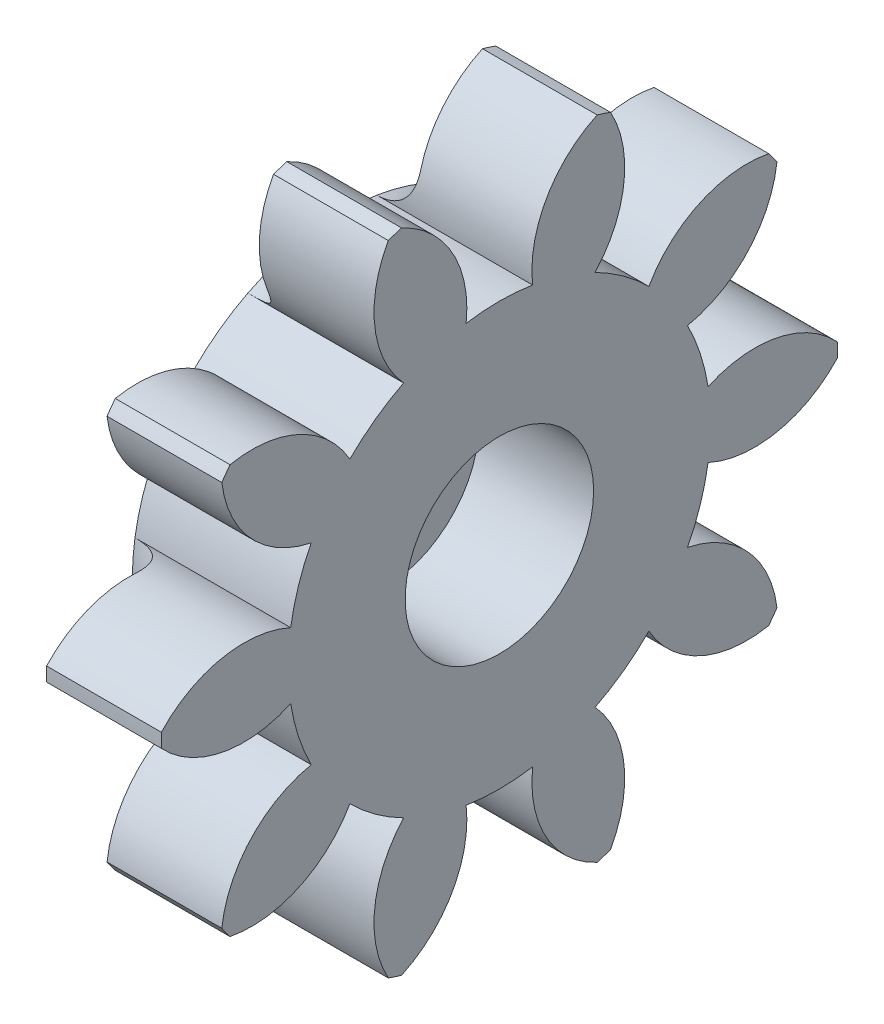
from build123d import *

# Parameters (mm, degrees)
BASPROSKE_W         = 2
BASPROSKE_H         = 8.25
TOOTHCUT_DEPTH      = 12.837440602
TEETHCUTS_COUNT     = 10
TEETHCUTS_ANGLE     = 324
BORSKE_R            = 2.5
BORE_DEPTH          = 50.0000508
BOSS_EXTRUDE1_START = 0.8
SKETCH1_R           = 2.5
BOSS_EXTRUDE1_DEPTH = 0.8
SKETCH2_R           = 2.55
SKETCH2_R_2         = 2.3
BOSS_EXTRUDE2_DEPTH = 2.8
BOSS_EXTRUDE3_START = 1
SKETCH3_R           = 5.15525
SKETCH3_R_2         = 1
BOSS_EXTRUDE3_DEPTH = 1
FILLET1_R           = 1


with BuildPart() as part:
    # BasProSke → Base-Revolve (revolve)
    with BuildSketch(Plane(origin=(0, 0, 0), x_dir=(1, 0, 0), z_dir=(0, 1, 0)), mode=Mode.PRIVATE) as base_revolve_sk:
        with Locations((1, 4.125)):
            Rectangle(BASPROSKE_W, BASPROSKE_H)
    revolve(base_revolve_sk.sketch.rotate(Axis((-10, 0, 0), (1, 0, 0)), 180), axis=Axis((-10, 0, 0), (1, 0, 0)))

    # TooCutSke → ToothCut (cut, through all)
    with BuildSketch(Plane(origin=(0, 0, 0), x_dir=(0, 0, -1), z_dir=(1, 0, 0))):
        with BuildLine():
            ThreePointArc((0.810777273, 5.091094458), (0, 5.15525), (-0.810777273, 5.091094458))
            ThreePointArc((-0.810777273, 5.091094458), (-1.154893166, 6.765492881), (-2.421785774, 7.913102983))
            ThreePointArc((-2.421785774, 7.913102983), (0, 8.2754), (2.421785774, 7.913102983))
            ThreePointArc((2.421785774, 7.913102983), (1.154893166, 6.765492881), (0.810777273, 5.091094458))
        make_face()
    toothcut = extrude(amount=TOOTHCUT_DEPTH, mode=Mode.SUBTRACT)

    # TeethCuts: ToothCut ×10 about axis
    teethcuts_axis = Axis((-10, 0, 0), (1, 0, 0))
    for i in range(1, TEETHCUTS_COUNT):
        add(toothcut.rotate(teethcuts_axis, i * TEETHCUTS_ANGLE / (TEETHCUTS_COUNT - 1)), mode=Mode.SUBTRACT)

    # BorSke → Bore (cut, symmetric)
    with BuildSketch(Plane(origin=(0, 0, 0), x_dir=(0, 0, -1), z_dir=(1, 0, 0))):
        with Locations(Location((0, 0, 0), (0, 0, 180))):
            Circle(BORSKE_R)
    extrude(amount=BORE_DEPTH, both=True, mode=Mode.SUBTRACT)

    # Sketch1 → Boss-Extrude1 (add)
    with BuildSketch(Plane.ZY.offset(BOSS_EXTRUDE1_START)):
        with BuildLine():
            ThreePointArc((-5.092462515, 0.802139699), (-6.772423309, 0.99612057), (-8.248240616, 0.170372351))
            ThreePointArc((-8.248240616, 0.170372351), (-8.25, 0), (-8.248240616, -0.170372351))
            ThreePointArc((-8.248240616, -0.170372351), (-6.772423309, -0.99612057), (-5.092462515, -0.802139699))
            ThreePointArc((-5.092462515, -0.802139699), (-4.902934106, -1.59305986), (-4.591374603, -2.344329716))
            ThreePointArc((-4.591374603, -2.344329716), (-6.06451053, -3.174852073), (-6.773109188, -4.710360064))
            ThreePointArc((-6.773109188, -4.710360064), (-6.674390204, -4.849228331), (-6.572824477, -4.986028319))
            ThreePointArc((-6.572824477, -4.986028319), (-4.893500569, -4.786609013), (-3.648402832, -3.642219012))
            ThreePointArc((-3.648402832, -3.642219012), (-3.030179922, -4.17068486), (-2.336537648, -4.59534486))
            ThreePointArc((-2.336537648, -4.59534486), (-3.040160855, -6.133139134), (-2.710880259, -7.791895034))
            ThreePointArc((-2.710880259, -7.791895034), (-2.549390204, -7.846216259), (-2.386812789, -7.897190938))
            ThreePointArc((-2.386812789, -7.897190938), (-1.145426936, -6.748775503), (-0.810777273, -5.091094458))
            ThreePointArc((-0.810777273, -5.091094458), (0, -5.15525), (0.810777273, -5.091094458))
            ThreePointArc((0.810777273, -5.091094458), (1.145426936, -6.748775503), (2.386812789, -7.897190938))
            ThreePointArc((2.386812789, -7.897190938), (2.549390204, -7.846216259), (2.710880259, -7.791895034))
            ThreePointArc((2.710880259, -7.791895034), (3.040160855, -6.133139134), (2.336537648, -4.59534486))
            ThreePointArc((2.336537648, -4.59534486), (3.030179922, -4.17068486), (3.648402832, -3.642219012))
            ThreePointArc((3.648402832, -3.642219012), (4.893500569, -4.786609013), (6.572824477, -4.986028319))
            ThreePointArc((6.572824477, -4.986028319), (6.674390204, -4.849228331), (6.773109188, -4.710360064))
            ThreePointArc((6.773109188, -4.710360064), (6.06451053, -3.174852073), (4.591374603, -2.344329716))
            ThreePointArc((4.591374603, -2.344329716), (4.902934106, -1.59305986), (5.092462515, -0.802139699))
            ThreePointArc((5.092462515, -0.802139699), (6.772423309, -0.99612057), (8.248240616, -0.170372351))
            ThreePointArc((8.248240616, -0.170372351), (8.25, 0), (8.248240616, 0.170372351))
            ThreePointArc((8.248240616, 0.170372351), (6.772423309, 0.99612057), (5.092462515, 0.802139699))
            ThreePointArc((5.092462515, 0.802139699), (4.902934106, 1.59305986), (4.591374603, 2.344329716))
            ThreePointArc((4.591374603, 2.344329716), (6.06451053, 3.174852073), (6.773109188, 4.710360064))
            ThreePointArc((6.773109188, 4.710360064), (6.674390204, 4.849228331), (6.572824477, 4.986028319))
            ThreePointArc((6.572824477, 4.986028319), (4.893500569, 4.786609013), (3.648402832, 3.642219012))
            ThreePointArc((3.648402832, 3.642219012), (3.030179922, 4.17068486), (2.336537648, 4.59534486))
            ThreePointArc((2.336537648, 4.59534486), (3.040160855, 6.133139134), (2.710880259, 7.791895034))
            ThreePointArc((2.710880259, 7.791895034), (2.549390204, 7.846216259), (2.386812789, 7.897190938))
            ThreePointArc((2.386812789, 7.897190938), (1.145426936, 6.748775503), (0.810777273, 5.091094458))
            ThreePointArc((0.810777273, 5.091094458), (0, 5.15525), (-0.810777273, 5.091094458))
            ThreePointArc((-0.810777273, 5.091094458), (-1.145426936, 6.748775503), (-2.386812789, 7.897190938))
            ThreePointArc((-2.386812789, 7.897190938), (-2.549390204, 7.846216259), (-2.710880259, 7.791895034))
            ThreePointArc((-2.710880259, 7.791895034), (-3.040160855, 6.133139134), (-2.336537648, 4.59534486))
            ThreePointArc((-2.336537648, 4.59534486), (-3.030179922, 4.17068486), (-3.648402832, 3.642219012))
            ThreePointArc((-3.648402832, 3.642219012), (-4.893500569, 4.786609013), (-6.572824477, 4.986028319))
            ThreePointArc((-6.572824477, 4.986028319), (-6.674390204, 4.849228331), (-6.773109188, 4.710360064))
            ThreePointArc((-6.773109188, 4.710360064), (-6.06451053, 3.174852073), (-4.591374603, 2.344329716))
            ThreePointArc((-4.591374603, 2.344329716), (-4.902934106, 1.59305986), (-5.092462515, 0.802139699))
        make_face()
        Circle(SKETCH1_R, mode=Mode.SUBTRACT)
    extrude(amount=-BOSS_EXTRUDE1_DEPTH)

    # Sketch2 → Boss-Extrude2 (add)
    with BuildSketch(Plane(origin=(2, 0, 0), x_dir=(0, 0, -1), z_dir=(1, 0, 0))):
        Circle(SKETCH2_R)
        Circle(SKETCH2_R_2, mode=Mode.SUBTRACT)
    extrude(amount=-BOSS_EXTRUDE2_DEPTH)

    # Sketch3 → Boss-Extrude3 (add)
    with BuildSketch(Plane.ZY.offset(0.8).offset(BOSS_EXTRUDE3_START)):
        Circle(SKETCH3_R)
        Circle(SKETCH3_R_2, mode=Mode.SUBTRACT)
    extrude(amount=-BOSS_EXTRUDE3_DEPTH)

    # Fillet1
    # the kernel refuses this fillet: 1 mm, written as the material it adds along each edge
    with BuildSketch(Plane(origin=(-0.8, 0, 0), x_dir=(0, 0.9470030124254241, 0.32122467909108776), z_dir=(0, -0.32122467909108776, 0.9470030124254241))) as fillet1_piece_1_section:
        with BuildLine():
            CenterArc((5.15525 + FILLET1_R, FILLET1_R), FILLET1_R, 180, 90)
            Line((5.15525, FILLET1_R), (5.15525, 0))
            Line((5.15525, 0), (5.15525 + FILLET1_R, 0))
        make_face()
    fillet1_piece_1 = revolve(axis=Axis((-0.8, 0, 0), (-1, 0, 0)), revolution_arc=73.474008917, mode=Mode.PRIVATE)
    fillet1_piece_1 = fillet1_piece_1 & Plane(origin=(-1.016803589, 5.402111134, 3.543133148), x_dir=(0, 0.9073017469464888, -0.4204801303127767), z_dir=(-1, 0, 0)) * Cylinder(2.75, 25, mode=Mode.PRIVATE)
    add(fillet1_piece_1)
    with BuildSketch(Plane(origin=(-0.8, 0, 0), x_dir=(0, 0.9470030124254241, 0.32122467909108776), z_dir=(0, -0.32122467909108776, 0.9470030124254241))) as fillet1_piece_2_section:
        with BuildLine():
            CenterArc((5.15525 + FILLET1_R, FILLET1_R), FILLET1_R, 180, 90)
            Line((5.15525, FILLET1_R), (5.15525, 0))
            Line((5.15525, 0), (5.15525 + FILLET1_R, 0))
        make_face()
    fillet1_piece_2 = revolve(axis=Axis((-0.8, 0, 0), (-1, 0, 0)), revolution_arc=73.474008917, mode=Mode.PRIVATE)
    fillet1_piece_2 = fillet1_piece_2 & Plane(origin=(-1.016452292, 5.402111134, -3.543133148), x_dir=(0, 0.9130879452722035, 0.40776268122350984), z_dir=(-1, 0, 0)) * Cylinder(2.75, 25, mode=Mode.PRIVATE)
    fillet1_piece_2 = fillet1_piece_2 & Plane(origin=(-1.016452292, 6.453001124, -0.308826326), x_dir=(0, 0.4868705128259326, -0.8734741574543654), z_dir=(-1, 0, 0)) * Cylinder(2.75, 25, mode=Mode.PRIVATE)
    add(fillet1_piece_2)
    with BuildSketch(Plane(origin=(-0.8, 0, 0), x_dir=(0, 0.9470030124254241, 0.32122467909108776), z_dir=(0, -0.32122467909108776, 0.9470030124254241))) as fillet1_piece_3_section:
        with BuildLine():
            CenterArc((5.15525 + FILLET1_R, FILLET1_R), FILLET1_R, 180, 90)
            Line((5.15525, FILLET1_R), (5.15525, 0))
            Line((5.15525, 0), (5.15525 + FILLET1_R, 0))
        make_face()
    fillet1_piece_3 = revolve(axis=Axis((-0.8, 0, 0), (-1, 0, 0)), revolution_arc=73.474008917, mode=Mode.PRIVATE)
    fillet1_piece_3 = fillet1_piece_3 & Plane(origin=(-1.016803597, 2.287798302, -6.041736185), x_dir=(0, 0.4925166220961392, 0.8703030374294972), z_dir=(-1, 0, 0)) * Cylinder(2.75, 25, mode=Mode.PRIVATE)
    add(fillet1_piece_3)
    with BuildSketch(Plane(origin=(-0.8, 0, 0), x_dir=(0, 0.5981428488081331, -0.8013895010665482), z_dir=(0, 0.8013895010665482, 0.5981428488081331))) as fillet1_piece_4_section:
        with BuildLine():
            CenterArc((5.15525 + FILLET1_R, FILLET1_R), FILLET1_R, 180, 90)
            Line((5.15525 + FILLET1_R, 0), (5.15525, 0))
            Line((5.15525, 0), (5.15525, FILLET1_R))
        make_face()
    fillet1_piece_4 = revolve(axis=Axis((-0.8, 0, 0), (-1, 0, 0)), revolution_arc=73.474008917, mode=Mode.PRIVATE)
    fillet1_piece_4 = fillet1_piece_4 & Plane(origin=(-1.016803652, 5.039064014, -4.04282464), x_dir=(0, -0.11952870907404632, -0.9928307447430766), z_dir=(-1, 0, 0)) * Cylinder(2.75, 25, mode=Mode.PRIVATE)
    add(fillet1_piece_4)
    with BuildSketch(Plane(origin=(-0.8, 0, 0), x_dir=(0, 0.5981428488081331, -0.8013895010665482), z_dir=(0, 0.8013895010665482, 0.5981428488081331))) as fillet1_piece_5_section:
        with BuildLine():
            CenterArc((5.15525 + FILLET1_R, FILLET1_R), FILLET1_R, 180, 90)
            Line((5.15525 + FILLET1_R, 0), (5.15525, 0))
            Line((5.15525, 0), (5.15525, FILLET1_R))
        make_face()
    fillet1_piece_5 = revolve(axis=Axis((-0.8, 0, 0), (-1, 0, 0)), revolution_arc=73.474008917, mode=Mode.PRIVATE)
    fillet1_piece_5 = fillet1_piece_5 & Plane(origin=(-1.016452339, 1.700375722, -6.232601351), x_dir=(0, -0.680272026739137, -0.7329597326158014), z_dir=(-1, 0, 0)) * Cylinder(2.75, 25, mode=Mode.PRIVATE)
    fillet1_piece_5 = fillet1_piece_5 & Plane(origin=(-1.016452339, -1.700375722, -6.232601351), x_dir=(0, 0.9100056077143237, 0.41459594055958204), z_dir=(-1, 0, 0)) * Cylinder(2.75, 25, mode=Mode.PRIVATE)
    add(fillet1_piece_5)
    with BuildSketch(Plane(origin=(-0.8, 0, 0), x_dir=(0, 0.5981428488081331, -0.8013895010665482), z_dir=(0, 0.8013895010665482, 0.5981428488081331))) as fillet1_piece_6_section:
        with BuildLine():
            CenterArc((5.15525 + FILLET1_R, FILLET1_R), FILLET1_R, 180, 90)
            Line((5.15525 + FILLET1_R, 0), (5.15525, 0))
            Line((5.15525, 0), (5.15525, FILLET1_R))
        make_face()
    fillet1_piece_6 = revolve(axis=Axis((-0.8, 0, 0), (-1, 0, 0)), revolution_arc=73.474008917, mode=Mode.PRIVATE)
    fillet1_piece_6 = fillet1_piece_6 & Plane(origin=(-1.016803584, -5.039064014, -4.04282464), x_dir=(0, 0.9799033811386385, -0.1994727140063633), z_dir=(-1, 0, 0)) * Cylinder(2.75, 25, mode=Mode.PRIVATE)
    add(fillet1_piece_6)
    with BuildSketch(Plane(origin=(-0.8, 0, 0), x_dir=(0, -0.5773304017343057, -0.8165106289775445), z_dir=(0, 0.8165106289775445, -0.5773304017343057))) as fillet1_piece_7_section:
        with BuildLine():
            CenterArc((5.15525 + FILLET1_R, FILLET1_R), FILLET1_R, 180, 90)
            Line((5.15525 + FILLET1_R, 0), (5.15525, 0))
            Line((5.15525, 0), (5.15525, FILLET1_R))
        make_face()
    fillet1_piece_7 = revolve(axis=Axis((-0.8, 0, 0), (-1, 0, 0)), revolution_arc=73.474008917, mode=Mode.PRIVATE)
    fillet1_piece_7 = fillet1_piece_7 & Plane(origin=(-1.016803652, -2.287798302, -6.041736185), x_dir=(0, -0.9811745517856529, -0.19312301501432474), z_dir=(-1, 0, 0)) * Cylinder(2.75, 25, mode=Mode.PRIVATE)
    add(fillet1_piece_7)
    with BuildSketch(Plane(origin=(-0.8, 0, 0), x_dir=(0, -0.5773304017343057, -0.8165106289775445), z_dir=(0, 0.8165106289775445, -0.5773304017343057))) as fillet1_piece_8_section:
        with BuildLine():
            CenterArc((5.15525 + FILLET1_R, FILLET1_R), FILLET1_R, 180, 90)
            Line((5.15525 + FILLET1_R, 0), (5.15525, 0))
            Line((5.15525, 0), (5.15525, FILLET1_R))
        make_face()
    fillet1_piece_8 = revolve(axis=Axis((-0.8, 0, 0), (-1, 0, 0)), revolution_arc=73.474008917, mode=Mode.PRIVATE)
    fillet1_piece_8 = fillet1_piece_8 & Plane(origin=(-1.016452339, -5.402111134, -3.543133148), x_dir=(0, -0.907301746946492, 0.42048013031276976), z_dir=(-1, 0, 0)) * Cylinder(2.75, 25, mode=Mode.PRIVATE)
    fillet1_piece_8 = fillet1_piece_8 & Plane(origin=(-1.016452339, -6.453001124, -0.308826326), x_dir=(0, 0.6755113686589356, -0.7373495716500632), z_dir=(-1, 0, 0)) * Cylinder(2.75, 25, mode=Mode.PRIVATE)
    add(fillet1_piece_8)
    with BuildSketch(Plane(origin=(-0.8, 0, 0), x_dir=(0, -0.5773304017343057, -0.8165106289775445), z_dir=(0, 0.8165106289775445, -0.5773304017343057))) as fillet1_piece_9_section:
        with BuildLine():
            CenterArc((5.15525 + FILLET1_R, FILLET1_R), FILLET1_R, 180, 90)
            Line((5.15525 + FILLET1_R, 0), (5.15525, 0))
            Line((5.15525, 0), (5.15525, FILLET1_R))
        make_face()
    fillet1_piece_9 = revolve(axis=Axis((-0.8, 0, 0), (-1, 0, 0)), revolution_arc=73.474008917, mode=Mode.PRIVATE)
    fillet1_piece_9 = fillet1_piece_9 & Plane(origin=(-1.016803584, -5.402111134, 3.543133148), x_dir=(0, 0.11309697313847777, -0.9935839545136156), z_dir=(-1, 0, 0)) * Cylinder(2.75, 25, mode=Mode.PRIVATE)
    add(fillet1_piece_9)
    with BuildSketch(Plane(origin=(-0.8, 0, 0), x_dir=(0, -0.9549526598185631, 0.296758180182875), z_dir=(0, -0.296758180182875, -0.9549526598185631))) as fillet1_piece_10_section:
        with BuildLine():
            CenterArc((5.15525 + FILLET1_R, FILLET1_R), FILLET1_R, 180, 90)
            Line((5.15525 + FILLET1_R, 0), (5.15525, 0))
            Line((5.15525, 0), (5.15525, FILLET1_R))
        make_face()
    fillet1_piece_10 = revolve(axis=Axis((-0.8, 0, 0), (-1, 0, 0)), revolution_arc=73.474008917, mode=Mode.PRIVATE)
    fillet1_piece_10 = fillet1_piece_10 & Plane(origin=(-1.016803652, -6.453001124, 0.308826326), x_dir=(0, -0.486870512825926, 0.8734741574543691), z_dir=(-1, 0, 0)) * Cylinder(2.75, 25, mode=Mode.PRIVATE)
    add(fillet1_piece_10)
    with BuildSketch(Plane(origin=(-0.8, 0, 0), x_dir=(0, -0.9549526598185631, 0.296758180182875), z_dir=(0, -0.296758180182875, -0.9549526598185631))) as fillet1_piece_11_section:
        with BuildLine():
            CenterArc((5.15525 + FILLET1_R, FILLET1_R), FILLET1_R, 180, 90)
            Line((5.15525 + FILLET1_R, 0), (5.15525, 0))
            Line((5.15525, 0), (5.15525, FILLET1_R))
        make_face()
    fillet1_piece_11 = revolve(axis=Axis((-0.8, 0, 0), (-1, 0, 0)), revolution_arc=73.474008917, mode=Mode.PRIVATE)
    fillet1_piece_11 = fillet1_piece_11 & Plane(origin=(-1.016452339, -5.039064014, 4.04282464), x_dir=(0, 0.11952870907405411, 0.9928307447430756), z_dir=(-1, 0, 0)) * Cylinder(2.75, 25, mode=Mode.PRIVATE)
    fillet1_piece_11 = fillet1_piece_11 & Plane(origin=(-1.016452339, -2.287798302, 6.041736185), x_dir=(0, -0.4925166220961448, -0.8703030374294941), z_dir=(-1, 0, 0)) * Cylinder(2.75, 25, mode=Mode.PRIVATE)
    add(fillet1_piece_11)
    with BuildSketch(Plane(origin=(-0.8, 0, 0), x_dir=(0, -0.9549526598185631, 0.296758180182875), z_dir=(0, -0.296758180182875, -0.9549526598185631))) as fillet1_piece_12_section:
        with BuildLine():
            CenterArc((5.15525 + FILLET1_R, FILLET1_R), FILLET1_R, 180, 90)
            Line((5.15525 + FILLET1_R, 0), (5.15525, 0))
            Line((5.15525, 0), (5.15525, FILLET1_R))
        make_face()
    fillet1_piece_12 = revolve(axis=Axis((-0.8, 0, 0), (-1, 0, 0)), revolution_arc=73.474008917, mode=Mode.PRIVATE)
    fillet1_piece_12 = fillet1_piece_12 & Plane(origin=(-1.016803584, 1.700375722, 6.232601351), x_dir=(0, -0.9100056077143265, -0.4145959405595758), z_dir=(-1, 0, 0)) * Cylinder(2.75, 25, mode=Mode.PRIVATE)
    add(fillet1_piece_12)
    with BuildSketch(Plane(origin=(-0.8, 0, 0), x_dir=(0, -0.012862799680675982, 0.9999172707701247), z_dir=(0, -0.9999172707701247, -0.012862799680675982))) as fillet1_piece_13_section:
        with BuildLine():
            CenterArc((5.15525 + FILLET1_R, FILLET1_R), FILLET1_R, 180, 90)
            Line((5.15525 + FILLET1_R, 0), (5.15525, 0))
            Line((5.15525, 0), (5.15525, FILLET1_R))
        make_face()
    fillet1_piece_13 = revolve(axis=Axis((-0.8, 0, 0), (-1, 0, 0)), revolution_arc=73.474008917, mode=Mode.PRIVATE)
    fillet1_piece_13 = fillet1_piece_13 & Plane(origin=(-1.016803652, -1.700375722, 6.232601351), x_dir=(0, 0.6802720267391439, 0.732959732615795), z_dir=(-1, 0, 0)) * Cylinder(2.75, 25, mode=Mode.PRIVATE)
    add(fillet1_piece_13)
    with BuildSketch(Plane(origin=(-0.8, 0, 0), x_dir=(0, -0.012862799680675982, 0.9999172707701247), z_dir=(0, -0.9999172707701247, -0.012862799680675982))) as fillet1_piece_14_section:
        with BuildLine():
            CenterArc((5.15525 + FILLET1_R, FILLET1_R), FILLET1_R, 180, 90)
            Line((5.15525 + FILLET1_R, 0), (5.15525, 0))
            Line((5.15525, 0), (5.15525, FILLET1_R))
        make_face()
    fillet1_piece_14 = revolve(axis=Axis((-0.8, 0, 0), (-1, 0, 0)), revolution_arc=73.474008917, mode=Mode.PRIVATE)
    fillet1_piece_14 = fillet1_piece_14 & Plane(origin=(-1.016452339, 2.287798302, 6.041736185), x_dir=(0, 0.9811745517856549, 0.1931230150143148), z_dir=(-1, 0, 0)) * Cylinder(2.75, 25, mode=Mode.PRIVATE)
    fillet1_piece_14 = fillet1_piece_14 & Plane(origin=(-1.016452339, 5.039064014, 4.04282464), x_dir=(0, -0.9799033811386372, 0.19947271400636937), z_dir=(-1, 0, 0)) * Cylinder(2.75, 25, mode=Mode.PRIVATE)
    add(fillet1_piece_14)
    with BuildSketch(Plane(origin=(-0.8, 0, 0), x_dir=(0, -0.012862799680675982, 0.9999172707701247), z_dir=(0, -0.9999172707701247, -0.012862799680675982))) as fillet1_piece_15_section:
        with BuildLine():
            CenterArc((5.15525 + FILLET1_R, FILLET1_R), FILLET1_R, 180, 90)
            Line((5.15525 + FILLET1_R, 0), (5.15525, 0))
            Line((5.15525, 0), (5.15525, FILLET1_R))
        make_face()
    fillet1_piece_15 = revolve(axis=Axis((-0.8, 0, 0), (-1, 0, 0)), revolution_arc=73.474008917, mode=Mode.PRIVATE)
    fillet1_piece_15 = fillet1_piece_15 & Plane(origin=(-1.016803584, 6.453001124, 0.308826326), x_dir=(0, -0.6755113686589296, 0.7373495716500688), z_dir=(-1, 0, 0)) * Cylinder(2.75, 25, mode=Mode.PRIVATE)
    add(fillet1_piece_15)


solid = part.part
